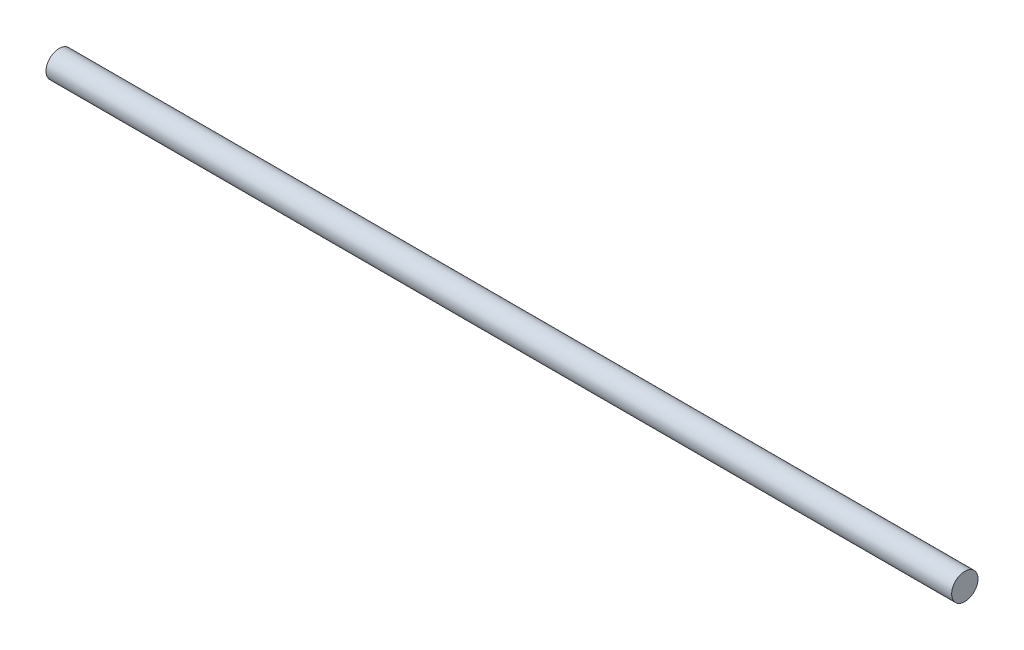
from build123d import *

# Parameters (mm, degrees)
SECTION_SKETCH_R     = 4
EXTRUDE_LENGTH_DEPTH = 275


with BuildPart() as part:
    # Section Sketch → Extrude Length (new body)
    with BuildSketch(Plane(origin=(0, 0, 0), x_dir=(0, 0, -1), z_dir=(1, 0, 0))):
        Circle(SECTION_SKETCH_R)
    extrude(amount=EXTRUDE_LENGTH_DEPTH)


solid = part.part
